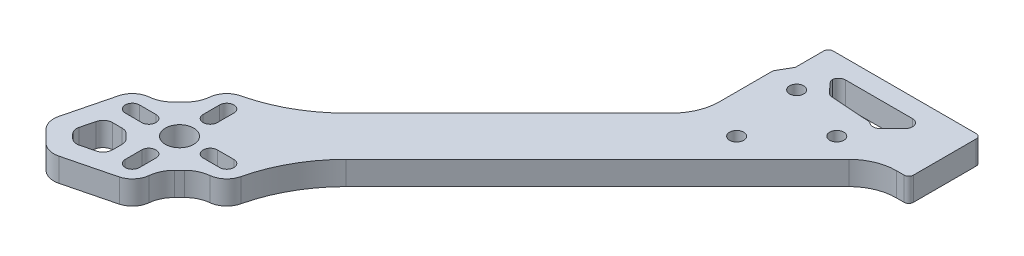
from build123d import *

# Parameters (mm, degrees)
SKETCH2_R           = 3.0000000000000018
SKETCH2_R_2         = 1.4999999999993736
SKETCH2_R_3         = 1.5000000000000009
SKETCH2_R_4         = 1.4999999999993723
BOSS_EXTRUDE1_DEPTH = 5
FILLET1_R           = 1.5
FILLET3_R           = 10
FILLET5_R           = 10
CHAMFER1_SIZE       = 4.5
FILLET6_R           = 6
FILLET7_R           = 4
FILLET8_R           = 2
FILLET9_R           = 30
FILLET10_R          = 1


with BuildPart() as part:
    # Sketch2 → Boss-Extrude1 (new body)
    with BuildSketch(Plane(origin=(0, 0, 0), x_dir=(1, 0, 0), z_dir=(0, 1, 0))):
        with BuildLine():
            Line((-46.189355852298796, -96.42025186017804), (-39.496927389393186, -89.72782339727232))
            Line((-39.496927389393186, -89.72782339727232), (17.913506363615255, -32.31738964426288))
            Line((17.913506363615255, -32.31738964426288), (24.678224989376695, -32.31738964426288))
            Line((24.678224989376695, -32.31738964426288), (24.678224989376428, -17.06738964426295))
            Line((24.678224989376428, -17.06738964426295), (-7.595965049770856, -17.06738964426337))
            Line((-7.595965049770856, -17.06738964426337), (-7.595965049770857, -24.067389644263372))
            Line((-7.595965049770857, -24.067389644263372), (-9.321775010623746, -27.06012368042446))
            Line((-9.321775010623746, -27.06012368042446), (-9.32177501062375, -37.06738964426337))
            Line((-9.32177501062375, -37.06738964426337), (-9.321775010623757, -42.58210827002507))
            Line((-9.321775010623753, -42.58210827002507), (-54.6598701272448, -87.9202033866469))
            Line((-54.6598701272448, -87.9202033866469), (-60.17458875300816, -87.92020338664692))
            ThreePointArc((-60.17458875300816, -87.92020338664692), (-63.00301587775435, -89.09177626190073), (-64.17458875300817, -91.92020338664692))
            Line((-64.17458875300817, -91.92020338664692), (-64.17458875300817, -97.92020338664689))
            Line((-64.17458875300817, -97.92020338664689), (-70.17458875301077, -97.92020338664689))
            ThreePointArc((-70.17458875301077, -97.92020338664689), (-72.6339398041774, -98.76558892412923), (-74.05374095021992, -100.9444071830841))
            Line((-74.05374095021992, -100.9444071830841), (-77.14515150148509, -113.23391188563446))
            Line((-77.14515150148509, -113.23391188563446), (-71.4882972519927, -118.89076613512684))
            Line((-71.4882972519927, -118.89076613512684), (-59.047429208957894, -115.75810794021132))
            ThreePointArc((-59.047429208957894, -115.75810794021132), (-56.9723521770992, -114.3172183869977), (-56.174588753010745, -111.92020338664949))
            Line((-56.174588753010745, -111.92020338664949), (-56.174588753010745, -105.92020338664949))
            Line((-56.174588753010745, -105.92020338664949), (-50.174588753008145, -105.92020338664949))
            ThreePointArc((-50.174588753008145, -105.92020338664949), (-47.34616162826196, -104.74863051139567), (-46.174588753008145, -101.92020338664949))
            Line((-46.174588753008145, -101.92020338664949), (-46.17464642427909, -101.89872393503671))
            Line((-46.17464642427909, -101.89872393503671), (-46.189355852298796, -96.42025186017804))
        make_face()
        Polygon((-70.26446914062754, -114.4577399969996), (-72.71257361922765, -112.00963551839949), (-71.33075600396296, -106.51639746436214), (-66.89210317428027, -106.51639746436214), (-64.77078283072062, -108.63771780792177), (-64.7707828307206, -113.0744087552009), align=None, mode=Mode.SUBTRACT)
        with BuildLine():
            ThreePointArc((-61.67458875301074, -108.42020338664949), (-60.17458875301075, -106.92020338664949), (-58.67458875301077, -108.42020338664949))
            Line((-58.67458875301077, -108.42020338664949), (-58.674588753010774, -111.92020338664949))
            ThreePointArc((-58.674588753010774, -111.92020338664949), (-60.17458875301075, -113.42020338664946), (-61.67458875301073, -111.92020338664949))
            Line((-61.67458875301073, -111.92020338664949), (-61.67458875301074, -108.42020338664949))
        make_face(mode=Mode.SUBTRACT)
        with BuildLine():
            ThreePointArc((-66.67458875301074, -100.42020338664692), (-65.17458875301071, -101.92020338664692), (-66.67458875301074, -103.42020338664692))
            Line((-66.67458875301074, -103.42020338664692), (-70.17458875301077, -103.42020338664692))
            ThreePointArc((-70.17458875301077, -103.42020338664692), (-71.67458875301075, -101.92020338664692), (-70.17458875301077, -100.42020338664692))
            Line((-70.17458875301077, -100.4202033866469), (-66.67458875301074, -100.4202033866469))
        make_face(mode=Mode.SUBTRACT)
        with Locations(Location((-60.174588753008145, -101.92020338664949, 0), (0, 0, 270))):
            Circle(SKETCH2_R, mode=Mode.SUBTRACT)
        with BuildLine():
            ThreePointArc((-53.67458875300815, -103.42020338664949), (-55.17458875300815, -101.92020338664949), (-53.67458875300815, -100.42020338664949))
            Line((-53.67458875300815, -100.42020338664949), (-50.174588753008145, -100.42020338664949))
            ThreePointArc((-50.174588753008145, -100.42020338664949), (-48.67458875300816, -101.92020338664949), (-50.174588753008145, -103.42020338664949))
            Line((-50.174588753008145, -103.42020338664949), (-53.67458875300815, -103.42020338664949))
        make_face(mode=Mode.SUBTRACT)
        with BuildLine():
            ThreePointArc((-58.67458875300815, -95.42020338664692), (-60.17458875300815, -96.9202033866469), (-61.67458875300815, -95.42020338664692))
            Line((-61.674588753008145, -95.42020338664692), (-61.67458875300816, -91.92020338664692))
            ThreePointArc((-61.67458875300816, -91.92020338664692), (-60.174588753008145, -90.42020338664689), (-58.67458875300813, -91.92020338664692))
            Line((-58.67458875300813, -91.92020338664692), (-58.674588753008145, -95.42020338664692))
        make_face(mode=Mode.SUBTRACT)
        with Locations(Location((-1.1783767284213562, -42.92399136206118, 0), (0, 0, 270))):
            Circle(SKETCH2_R_2, mode=Mode.SUBTRACT)
        with Locations(Location((-3.3217750106237407, -28.067389644263372, 0), (0, 0, 270))):
            Circle(SKETCH2_R_3, mode=Mode.SUBTRACT)
        with Locations(Location((9.428224989376764, -32.31738964426288, 0), (0, 0, 270))):
            Circle(SKETCH2_R_4, mode=Mode.SUBTRACT)
        Polygon((1.0820753752795897, -25.575281589539195), (-1.459873180493811, -22.79599601598655), (-1.4598731804937872, -21.06738964426295), (17.849797864630506, -21.06738964426295), (11.740910030340089, -27.17627747855337), (10.272484798754686, -26.22755837455273), align=None, mode=Mode.SUBTRACT)
    extrude(amount=BOSS_EXTRUDE1_DEPTH)

    # Fillet1
    # the kernel refuses this fillet: 1.5 mm, written as the material it adds along each edge
    with BuildSketch(Plane(origin=(1.0820753752795897, 0, 25.575281589539195), x_dir=(0.9974908468725838, 0, 0.07079555357093803), z_dir=(0, 1, 0))) as fillet1_piece_1:
        with BuildLine():
            CenterArc((FILLET1_R * 0.398900109333, FILLET1_R), FILLET1_R, 226.50587582859146, 43.4941241714086)
            Line((-FILLET1_R * 0.289380073746, FILLET1_R * 0.274555040282), (0, 0))
            Line((0, 0), (FILLET1_R * 0.398900109333, 0))
        make_face()
    extrude(amount=5)
    with BuildSketch(Plane(origin=(-1.459873180493811, 0, 22.79599601598655), x_dir=(1.372e-14, 0, -1), z_dir=(0, 1, 0))) as fillet1_piece_2:
        with BuildLine():
            CenterArc((FILLET1_R * 0.388338270451, -FILLET1_R), FILLET1_R, 89.99999999999997, 42.44619337739144)
            Line((-FILLET1_R * 0.286559260205, -FILLET1_R * 0.262088539786), (0, 0))
            Line((0, 0), (FILLET1_R * 0.388338270451, 0))
        make_face()
    extrude(amount=5)
    with BuildSketch(Plane(origin=(-1.459873180493787, 0, 21.06738964426295), x_dir=(1, 0, 0), z_dir=(0, 1, 0))) as fillet1_piece_3:
        with BuildLine():
            CenterArc((FILLET1_R, -FILLET1_R), FILLET1_R, 90, 89.99999999999918)
            Line((-2.087e-14, -FILLET1_R), (0, 0))
            Line((0, 0), (FILLET1_R, 0))
        make_face()
    extrude(amount=5)
    with BuildSketch(Plane(origin=(11.740910030340089, 0, 27.17627747855337), x_dir=(-0.839945220222329, 0, -0.5426711960530642), z_dir=(0, 1, 0))) as fillet1_piece_4:
        with BuildLine():
            CenterArc((FILLET1_R * 0.807844840446, -FILLET1_R), FILLET1_R, 89.99999999999994, 77.86566453571226)
            Line((-FILLET1_R * 0.169812603282, -FILLET1_R * 0.789795521639), (0, 0))
            Line((0, 0), (FILLET1_R * 0.807844840446, -3e-17))
        make_face()
    extrude(amount=5)
    with BuildSketch(Plane(origin=(17.849797864630506, 0, 21.06738964426295), x_dir=(-0.7071067811865475, 0, 0.7071067811865475), z_dir=(0, 1, 0))) as fillet1_piece_5:
        with BuildLine():
            CenterArc((FILLET1_R * 2.41421356237, -FILLET1_R), FILLET1_R, 89.99999999999994, 135.00000000000006)
            Line((FILLET1_R * 1.70710678119, -FILLET1_R * 1.70710678119), (0, 0))
            Line((0, 0), (FILLET1_R * 2.41421356237, 1e-17))
        make_face()
    extrude(amount=5)
    # the kernel refuses this fillet: 1.5 mm, written as the material it takes off along each edge
    with BuildSketch(Plane(origin=(10.27248479875469, -0.9630450228974294, 26.22755837455273), x_dir=(0.8399452202223279, 0, 0.5426711960530661), z_dir=(0, 1, 0))) as fillet1_2_piece_1:
        with BuildLine():
            CenterArc((FILLET1_R * 0.256812006106, -FILLET1_R), FILLET1_R, 90.00000000000006, 28.805982084511456)
            Line((-FILLET1_R * 0.225033157983, -FILLET1_R * 0.123743623222), (0, 0))
            Line((0, 0), (FILLET1_R * 0.256812006106, 2e-17))
        make_face()
    extrude(amount=6.92609004579486, mode=Mode.SUBTRACT)

    # Fillet3
    fillet3_edges = [part.edges().sort_by_distance(p)[0] for p in [
        (17.913506363615255, 2.5, 32.31738964426288),
    ]]
    fillet(fillet3_edges, radius=FILLET3_R)

    # Fillet5
    fillet5_edges = [part.edges().sort_by_distance(p)[0] for p in [
        (-9.321775010623755, 2.5, 42.58210827002507),
    ]]
    fillet(fillet5_edges, radius=FILLET5_R)

    # Chamfer1
    chamfer1_edges = [part.edges().sort_by_distance(p)[0] for p in [
        (-64.17458875300817, 2.5, 97.92020338664689),
        (-56.174588753010745, 2.5, 105.92020338664949),
    ]]
    chamfer(chamfer1_edges, length=CHAMFER1_SIZE)

    # Fillet6
    fillet6_edges = [part.edges().sort_by_distance(p)[0] for p in [
        (-64.17458875300817, 2.5, 93.42020338664689),
        (-68.67458875300817, 2.5, 97.92020338664689),
        (-56.174588753010745, 2.5, 110.42020338664949),
        (-51.674588753010745, 2.5, 105.92020338664949),
    ]]
    fillet(fillet6_edges, radius=FILLET6_R)

    # Fillet7
    fillet7_edges = [part.edges().sort_by_distance(p)[0] for p in [
        (-71.4882972519927, 2.5, 118.89076613512684),
        (-77.14515150148509, 2.5, 113.23391188563446),
    ]]
    fillet(fillet7_edges, radius=FILLET7_R)

    # Fillet8
    fillet8_edges = [part.edges().sort_by_distance(p)[0] for p in [
        (-72.71257361922765, 2.5, 112.00963551839949),
        (-70.26446914062754, 2.5, 114.4577399969996),
        (-64.7707828307206, 2.5, 113.0744087552009),
        (-64.77078283072062, 2.5, 108.63771780792177),
        (-66.89210317428027, 2.5, 106.51639746436214),
        (-71.33075600396296, 2.5, 106.51639746436214),
    ]]
    fillet(fillet8_edges, radius=FILLET8_R)

    # Fillet9
    fillet9_edges = [part.edges().sort_by_distance(p)[0] for p in [
        (-54.6598701272448, 2.5, 87.9202033866469),
        (-46.189355852298796, 2.5, 96.42025186017804),
    ]]
    fillet(fillet9_edges, radius=FILLET9_R)

    # Fillet10
    fillet10_edges = [part.edges().sort_by_distance(p)[0] for p in [
        (-7.595965049770856, 2.5, 17.06738964426337),
        (24.678224989376428, 2.5, 17.06738964426295),
        (24.678224989376695, 2.5, 32.31738964426288),
    ]]
    fillet(fillet10_edges, radius=FILLET10_R)


solid = part.part
